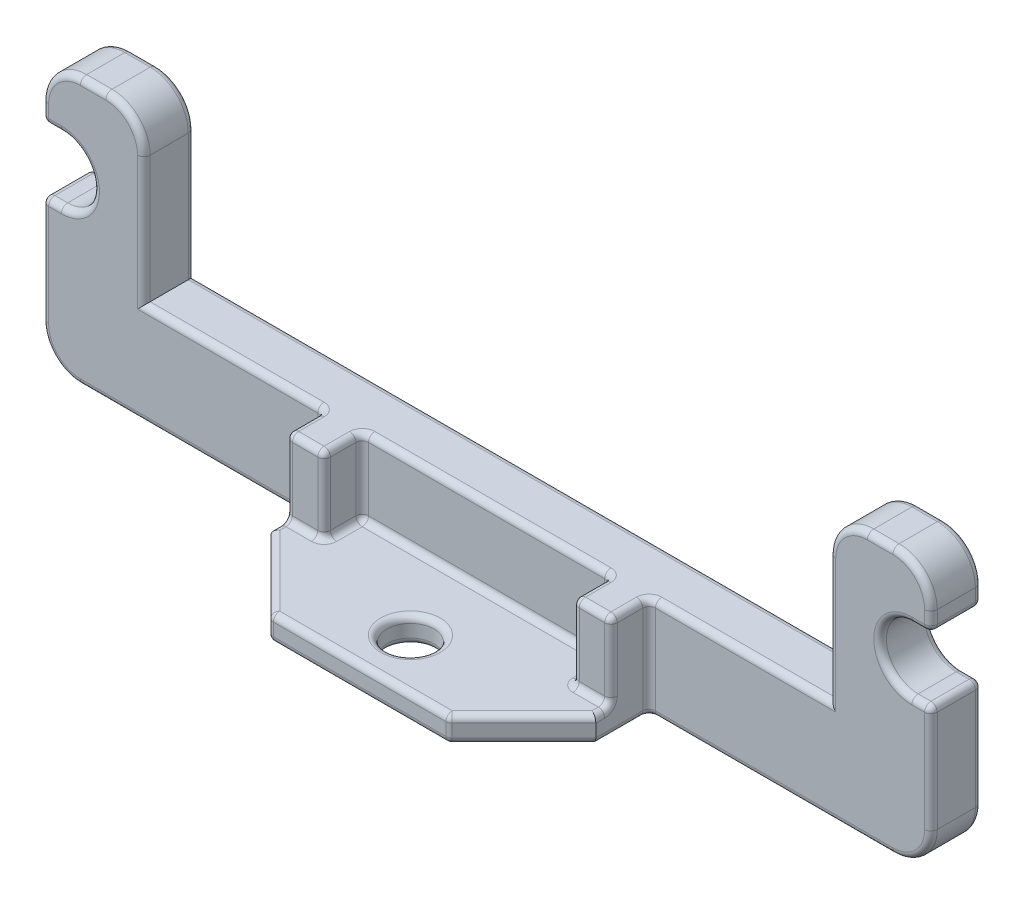
from build123d import *

# Parameters (mm, degrees)
BOSS_EXTRUDE1_DEPTH = 4
CUT_EXTRUDE1_DEPTH  = 6
SKETCH3_W           = 14
SKETCH3_H           = 2
BOSS_EXTRUDE2_DEPTH = 10
SKETCH4_R           = 1.85
CUT_EXTRUDE2_DEPTH  = 10
BOSS_EXTRUDE3_DEPTH = 2
SKETCH6_W           = 3
SKETCH6_H           = 3
BOSS_EXTRUDE4_DEPTH = 6
FILLET1_R           = 3
FILLET3_R           = 0.5
FILLET4_R           = 0.5
BOSS_EXTRUDE5_DEPTH = 2
FILLET6_R           = 0.5


with BuildPart() as part:
    # Sketch1 → Boss-Extrude1 (new body)
    with BuildSketch(Plane.XY):
        Polygon((-27, 4.030739026), (-27, 17.030739026), (-35, 17.030739026), (-35, -3.969260974), (35, -3.969260974), (35, 17.030739026), (27, 17.030739026), (27, 4.030739026), align=None)
    extrude(amount=BOSS_EXTRUDE1_DEPTH)

    # Sketch2 → Cut-Extrude1 (cut)
    with BuildSketch(Plane.XY.offset(4)):
        with BuildLine():
            Line((35, 7.530739026), (33.494865117, 7.530739026))
            ThreePointArc((33.494865117, 7.530739026), (30.994865117, 10.030739026), (33.494865117, 12.530739026))
            Line((33.494865117, 12.530739026), (35, 12.530739026))
            ThreePointArc((35, 12.530739026), (37.5, 10.030739026), (35, 7.530739026))
        make_face()
        with BuildLine():
            Line((-35, 7.530739026), (-33.494865117, 7.530739026))
            ThreePointArc((-33.494865117, 7.530739026), (-30.994865117, 10.030739026), (-33.494865117, 12.530739026))
            Line((-33.494865117, 12.530739026), (-35, 12.530739026))
            ThreePointArc((-35, 12.530739026), (-37.5, 10.030739026), (-35, 7.530739026))
        make_face()
    extrude(amount=-CUT_EXTRUDE1_DEPTH, mode=Mode.SUBTRACT)

    # Sketch3 → Boss-Extrude2 (add)
    with BuildSketch(Plane.XY.offset(4)):
        with Locations((0, -2.969260974)):
            Rectangle(SKETCH3_W, SKETCH3_H)
    extrude(amount=BOSS_EXTRUDE2_DEPTH)

    # Sketch4 → Cut-Extrude2 (cut)
    with BuildSketch(Plane(origin=(0, -1.969260974, 0), x_dir=(1, 0, 0), z_dir=(0, 1, 0))):
        with Locations(Location((0, -10, 0), (0, 0, 270))):
            Circle(SKETCH4_R)
    extrude(amount=-CUT_EXTRUDE2_DEPTH, mode=Mode.SUBTRACT)

    # Sketch5 → Boss-Extrude3 (add)
    with BuildSketch(Plane(origin=(0, -1.969260974, 0), x_dir=(1, 0, 0), z_dir=(0, 1, 0))):
        Polygon((7, -14), (12.8, -8.2), (12.8, -4), (7, -4), align=None)
        Polygon((-7, -14), (-12.8, -8.2), (-12.8, -4), (-7, -4), align=None)
    extrude(amount=-BOSS_EXTRUDE3_DEPTH)

    # Sketch6 → Boss-Extrude4 (add)
    with BuildSketch(Plane(origin=(0, -1.969260974, 0), x_dir=(1, 0, 0), z_dir=(0, 1, 0))):
        with Locations((-11.3, -5.5)):
            Rectangle(SKETCH6_W, SKETCH6_H)
        with Locations((11.3, -5.5)):
            Rectangle(SKETCH6_W, SKETCH6_H)
    extrude(amount=BOSS_EXTRUDE4_DEPTH)

    # Fillet1
    fillet1_edges = [part.edges().sort_by_distance(p)[0] for p in [
        (-35, -3.969260974, 2),
        (35, -3.969260974, 2),
        (35, 17.030739026, 2),
        (27, 17.030739026, 2),
        (-35, 17.030739026, 2),
        (-27, 17.030739026, 2),
    ]]
    fillet(fillet1_edges, radius=FILLET1_R)

    # Fillet3
    fillet3_edges = [part.edges().sort_by_distance(p)[0] for p in [
        (-12.8, -1.969260974, 7.6),
        (-19.9, 4.030739026, 4),
        (-9.8, 1.030739026, 4),
        (-9.8, 4.030739026, 5.5),
        (-9.8, 1.030739026, 7),
        (-9.8, -1.969260974, 5.5),
        (-11.3, 4.030739026, 7),
        (-12.8, 1.030739026, 7),
        (-11.3, -1.969260974, 7),
        (-12.8, 4.030739026, 5.5),
        (0, 4.030739026, 4),
        (0, -1.969260974, 4),
        (12.8, 4.030739026, 5.5),
        (12.8, 1.030739026, 7),
        (11.3, 4.030739026, 7),
        (9.8, 1.030739026, 7),
        (11.3, -1.969260974, 7),
        (9.8, 4.030739026, 5.5),
        (9.8, 1.030739026, 4),
        (9.8, -1.969260974, 5.5),
        (19.9, 4.030739026, 4),
        (-22.4, -3.969260974, 4),
        (0, -3.969260974, 0),
        (-35, 13.280739026, 0),
        (-31, 17.030739026, 0),
        (27, 9.030739026, 0),
        (31, 17.030739026, 0),
        (35, 3.280739026, 0),
        (-27.878679656, 16.152059369, 0),
        (-34.121320344, 16.152059369, 0),
        (27.878679656, 16.152059369, 0),
        (34.121320344, 16.152059369, 0),
        (34.121320344, -3.090581318, 0),
        (-34.121320344, -3.090581318, 0),
        (-31, 17.030739026, 4),
        (-35, 13.280739026, 4),
        (-27.878679656, 16.152059369, 4),
        (-34.121320344, 16.152059369, 4),
        (-34.121320344, -3.090581318, 4),
        (35, 3.280739026, 4),
        (31, 17.030739026, 4),
        (27, 9.030739026, 4),
        (27.878679656, 16.152059369, 4),
        (34.121320344, 16.152059369, 4),
        (34.121320344, -3.090581318, 4),
        (-27, 9.030739026, 4),
        (35, 13.280739026, 0),
        (34.247432558, 12.530739026, 0),
        (30.994865117, 10.030739026, 0),
        (34.247432558, 7.530739026, 0),
        (35, 13.280739026, 4),
        (34.247432558, 7.530739026, 4),
        (34.247432558, 12.530739026, 4),
        (30.994865117, 10.030739026, 4),
        (-35, 3.280739026, 0),
        (-34.247432558, 7.530739026, 0),
        (-30.994865117, 10.030739026, 0),
        (-34.247432558, 12.530739026, 0),
        (-35, 3.280739026, 4),
        (-34.247432558, 7.530739026, 4),
        (-30.994865117, 10.030739026, 4),
        (-34.247432558, 12.530739026, 4),
        (-7, -2.969260974, 14),
        (0, -3.969260974, 14),
        (7, -2.969260974, 14),
        (0, -1.969260974, 14),
        (0, -3.969260974, 8.15),
        (0, -1.969260974, 8.15),
        (22.4, -3.969260974, 4),
        (12.8, -3.969260974, 6.1),
        (12.8, 0.030739026, 4),
        (9.9, -3.969260974, 11.1),
        (9.9, -1.969260974, 11.1),
        (12.8, -1.969260974, 7.6),
        (-27, 9.030739026, 0),
        (0, 4.030739026, 0),
        (-9.9, -3.969260974, 11.1),
        (-12.8, -3.969260974, 6.1),
        (-12.8, 0.030739026, 4),
        (-9.9, -1.969260974, 11.1),
    ]]
    fillet(fillet3_edges, radius=FILLET3_R)

    # Fillet4
    # the kernel refuses this fillet: 0.5 mm, written as the material it takes off along each edge
    with BuildSketch(Plane(origin=(34.5, 13.030739026, 3.5), x_dir=(1, 0, 0), z_dir=(0, -1, 0))) as fillet4_piece_1_section:
        Polygon((0, 0), (FILLET4_R, 0), (FILLET4_R, FILLET4_R), (0, FILLET4_R), align=None)
    fillet4_piece_1 = extrude(amount=FILLET4_R, mode=Mode.PRIVATE)
    fillet4_piece_1 = fillet4_piece_1 - Plane(origin=(34.5, 13.030739026, 3.5), x_dir=(-0.7071067811865475, 0, -0.7071067811865475), z_dir=(0, -1, 0)) * Sphere(FILLET4_R, mode=Mode.PRIVATE)
    add(fillet4_piece_1, mode=Mode.SUBTRACT)
    with BuildSketch(Plane(origin=(34.5, 7.030739026, 3.5), x_dir=(0, 1, 0), z_dir=(1, 0, 0))) as fillet4_piece_2_section:
        Polygon((0, 0), (FILLET4_R, 0), (FILLET4_R, FILLET4_R), (0, FILLET4_R), align=None)
    fillet4_piece_2 = extrude(amount=FILLET4_R, mode=Mode.PRIVATE)
    fillet4_piece_2 = fillet4_piece_2 - Plane(origin=(34.5, 7.030739026, 3.5), x_dir=(0, -0.7071067811865475, -0.7071067811865475), z_dir=(1, 0, 0)) * Sphere(FILLET4_R, mode=Mode.PRIVATE)
    add(fillet4_piece_2, mode=Mode.SUBTRACT)
    with BuildSketch(Plane(origin=(-34.5, 13.030739026, 3.5), x_dir=(0, -1, 0), z_dir=(-1, 0, 0))) as fillet4_piece_3_section:
        Polygon((0, 0), (FILLET4_R, 0), (FILLET4_R, FILLET4_R), (0, FILLET4_R), align=None)
    fillet4_piece_3 = extrude(amount=FILLET4_R, mode=Mode.PRIVATE)
    fillet4_piece_3 = fillet4_piece_3 - Plane(origin=(-34.5, 13.030739026, 3.5), x_dir=(0, 0.7071067811865475, -0.7071067811865475), z_dir=(-1, 0, 0)) * Sphere(FILLET4_R, mode=Mode.PRIVATE)
    add(fillet4_piece_3, mode=Mode.SUBTRACT)
    with BuildSketch(Plane(origin=(-34.5, 7.030739026, 3.5), x_dir=(0, 1, 0), z_dir=(-1, 0, 0))) as fillet4_piece_4_section:
        Polygon((0, 0), (FILLET4_R, 0), (FILLET4_R, -FILLET4_R), (0, -FILLET4_R), align=None)
    fillet4_piece_4 = extrude(amount=FILLET4_R, mode=Mode.PRIVATE)
    fillet4_piece_4 = fillet4_piece_4 - Plane(origin=(-34.5, 7.030739026, 3.5), x_dir=(0, -0.7071067811865475, -0.7071067811865475), z_dir=(-1, 0, 0)) * Sphere(FILLET4_R, mode=Mode.PRIVATE)
    add(fillet4_piece_4, mode=Mode.SUBTRACT)
    with BuildSketch(Plane(origin=(-34.5, 13.030739026, 0.5), x_dir=(0, -1, 0), z_dir=(-1, 0, 0))) as fillet4_piece_5_section:
        Polygon((0, 0), (FILLET4_R, 0), (FILLET4_R, -FILLET4_R), (0, -FILLET4_R), align=None)
    fillet4_piece_5 = extrude(amount=FILLET4_R, mode=Mode.PRIVATE)
    fillet4_piece_5 = fillet4_piece_5 - Plane(origin=(-34.5, 13.030739026, 0.5), x_dir=(0, 0.7071067811865475, 0.7071067811865475), z_dir=(-1, 0, 0)) * Sphere(FILLET4_R, mode=Mode.PRIVATE)
    add(fillet4_piece_5, mode=Mode.SUBTRACT)
    with BuildSketch(Plane(origin=(34.5, 13.030739026, 0.5), x_dir=(1, 0, 0), z_dir=(0, -1, 0))) as fillet4_piece_6_section:
        Polygon((0, 0), (FILLET4_R, 0), (FILLET4_R, -FILLET4_R), (0, -FILLET4_R), align=None)
    fillet4_piece_6 = extrude(amount=FILLET4_R, mode=Mode.PRIVATE)
    fillet4_piece_6 = fillet4_piece_6 - Plane(origin=(34.5, 13.030739026, 0.5), x_dir=(-0.7071067811865475, 0, 0.7071067811865475), z_dir=(0, -1, 0)) * Sphere(FILLET4_R, mode=Mode.PRIVATE)
    add(fillet4_piece_6, mode=Mode.SUBTRACT)
    with BuildSketch(Plane(origin=(-34.5, 7.030739026, 0.5), x_dir=(0, 1, 0), z_dir=(-1, 0, 0))) as fillet4_piece_7_section:
        Polygon((0, 0), (FILLET4_R, 0), (FILLET4_R, FILLET4_R), (0, FILLET4_R), align=None)
    fillet4_piece_7 = extrude(amount=FILLET4_R, mode=Mode.PRIVATE)
    fillet4_piece_7 = fillet4_piece_7 - Plane(origin=(-34.5, 7.030739026, 0.5), x_dir=(0, -0.7071067811865475, 0.7071067811865475), z_dir=(-1, 0, 0)) * Sphere(FILLET4_R, mode=Mode.PRIVATE)
    add(fillet4_piece_7, mode=Mode.SUBTRACT)
    with BuildSketch(Plane(origin=(34.5, 7.030739026, 0.5), x_dir=(0, 1, 0), z_dir=(1, 0, 0))) as fillet4_piece_8_section:
        Polygon((0, 0), (FILLET4_R, 0), (FILLET4_R, -FILLET4_R), (0, -FILLET4_R), align=None)
    fillet4_piece_8 = extrude(amount=FILLET4_R, mode=Mode.PRIVATE)
    fillet4_piece_8 = fillet4_piece_8 - Plane(origin=(34.5, 7.030739026, 0.5), x_dir=(0, -0.7071067811865475, 0.7071067811865475), z_dir=(1, 0, 0)) * Sphere(FILLET4_R, mode=Mode.PRIVATE)
    add(fillet4_piece_8, mode=Mode.SUBTRACT)
    with BuildSketch(Plane(origin=(35, 7.530739026, 3.5), x_dir=(0, -1, 0), z_dir=(0, 0, -1)), Plane(origin=(35, 12.530739026, 3.5), x_dir=(-1, 0, 0), z_dir=(0, 0, -1)), Plane(origin=(-35, 12.530739026, 3.5), x_dir=(0, 1, 0), z_dir=(0, 0, -1))) as fillet4_piece_9:
        with BuildLine():
            CenterArc((FILLET4_R, FILLET4_R), FILLET4_R, 180, 90)
            Line((0, FILLET4_R), (0, 0))
            Line((0, 0), (FILLET4_R, 0))
        make_face()
    extrude(amount=3, mode=Mode.SUBTRACT)
    with BuildSketch(Plane(origin=(-35, 7.530739026, 3.5), x_dir=(0, -1, 0), z_dir=(0, 0, -1))) as fillet4_piece_10:
        with BuildLine():
            CenterArc((FILLET4_R, -FILLET4_R), FILLET4_R, 90, 90)
            Line((0, -FILLET4_R), (0, 0))
            Line((0, 0), (FILLET4_R, 0))
        make_face()
    extrude(amount=3, mode=Mode.SUBTRACT)

    # Sketch7 → Boss-Extrude5 (add, symmetric)
    with BuildSketch(Plane.XZ.offset(3.969260974)):
        with BuildLine():
            Line((-3.898717738, 1.9), (3.898717738, 1.9))
            ThreePointArc((3.898717738, 1.9), (0, -1.9), (-3.898717738, 1.9))
        make_face()
    extrude(amount=BOSS_EXTRUDE5_DEPTH, both=True)

    # Fillet6
    fillet6_edges = [part.edges().sort_by_distance(p)[0] for p in [
        (0, -1.969260974, -1.9),
        (0, -5.969260974, -1.9),
    ]]
    fillet(fillet6_edges, radius=FILLET6_R)


solid = part.part
